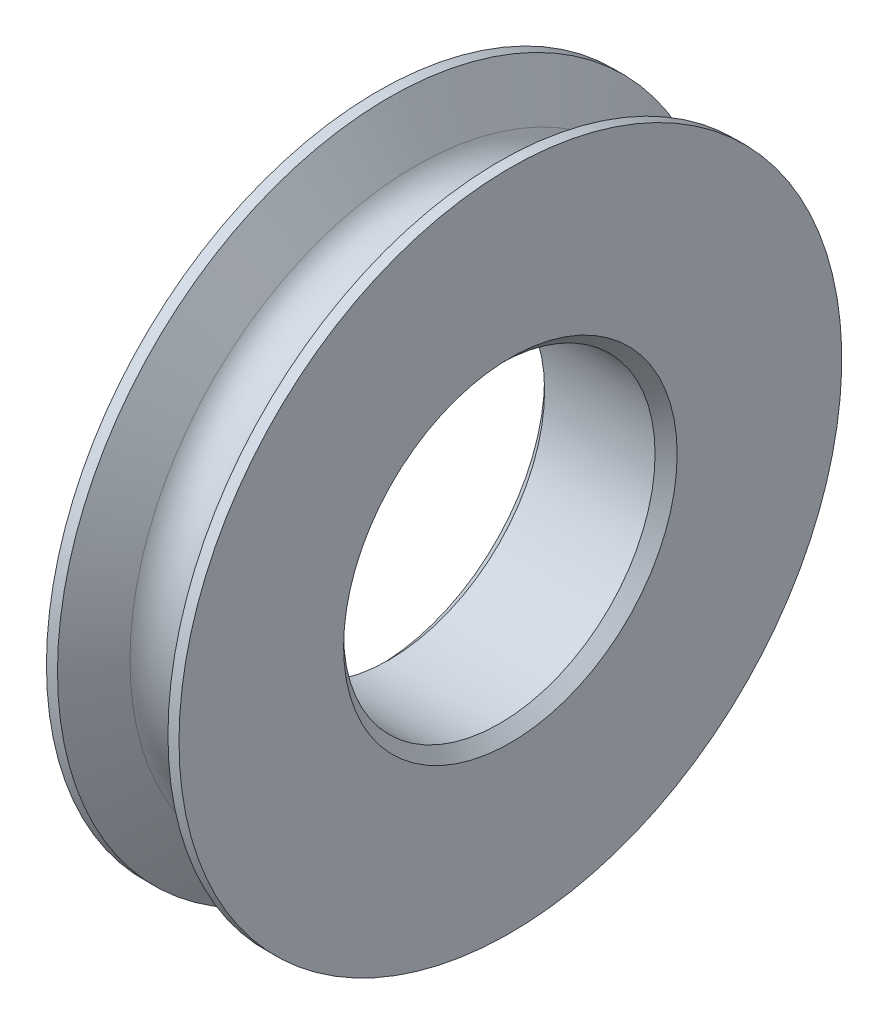
from build123d import *

# Parameters (mm, degrees)
CHAMFER_1_SIZE = 0.5


with BuildPart() as part:
    # 草图1 → 旋转1 (revolve)
    with BuildSketch(Plane.XY):
        with BuildLine():
            Line((-3, 7.05), (3, 7.05))
            Line((3, 7.05), (3, 15))
            Line((3, 15), (2.5, 15))
            Line((2.5, 15), (1.299038106, 12.919872981))
            ThreePointArc((1.299038106, 12.919872981), (0, 12.169872981), (-1.299038106, 12.919872981))
            Line((-1.299038106, 12.919872981), (-2.5, 15))
            Line((-2.5, 15), (-3, 15))
            Line((-3, 15), (-3, 7.05))
        make_face()
    revolve(axis=Axis((-10.233108396, 0, 0), (1, 0, 0)))

    # 倒角1
    chamfer_1_edges = [part.edges().sort_by_distance(p)[0] for p in [
        (3, -7.05, 0),
        (-3, -7.05, 0),
    ]]
    chamfer(chamfer_1_edges, length=CHAMFER_1_SIZE)


solid = part.part
